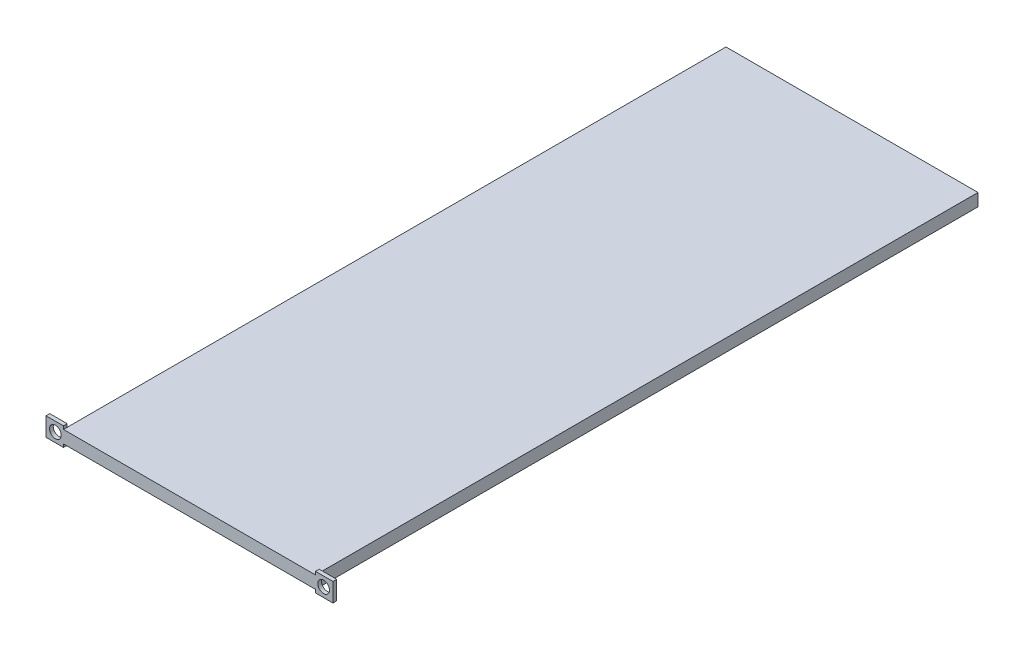
from build123d import *

# Parameters (mm, degrees)
SKETCH1_W           = 202
SKETCH1_H           = 10
BOSS_EXTRUDE1_DEPTH = 531
SKETCH2_W           = 3
SKETCH2_H           = 15
BOSS_EXTRUDE2_DEPTH = 14
SKETCH4_W           = 3
SKETCH4_H           = 15
BOSS_EXTRUDE3_DEPTH = 14
SKETCH3_R           = 4.7
CUT_EXTRUDE1_DEPTH  = 13


with BuildPart() as part:
    # Sketch1 → Boss-Extrude1 (new body)
    with BuildSketch(Plane.XY):
        with Locations((101, 5)):
            Rectangle(SKETCH1_W, SKETCH1_H)
    extrude(amount=BOSS_EXTRUDE1_DEPTH)

    # Sketch2 → Boss-Extrude2 (add)
    with BuildSketch(Plane.ZY):
        with Locations((529.5, 5)):
            Rectangle(SKETCH2_W, SKETCH2_H)
    extrude(amount=BOSS_EXTRUDE2_DEPTH)

    # Sketch4 → Boss-Extrude3 (add)
    with BuildSketch(Plane(origin=(202, 0, 0), x_dir=(0, 0, -1), z_dir=(1, 0, 0))):
        with Locations((-529.5, 5)):
            Rectangle(SKETCH4_W, SKETCH4_H)
    extrude(amount=BOSS_EXTRUDE3_DEPTH)

    # Sketch3 → Cut-Extrude1 (cut)
    with BuildSketch(Plane(origin=(0, 0, 528), x_dir=(-1, 0, 0), z_dir=(0, 0, -1))):
        with Locations((6.5, 5)):
            Circle(SKETCH3_R)
        with Locations((-208.5, 5)):
            Circle(SKETCH3_R)
    extrude(amount=-CUT_EXTRUDE1_DEPTH, mode=Mode.SUBTRACT)


solid = part.part
